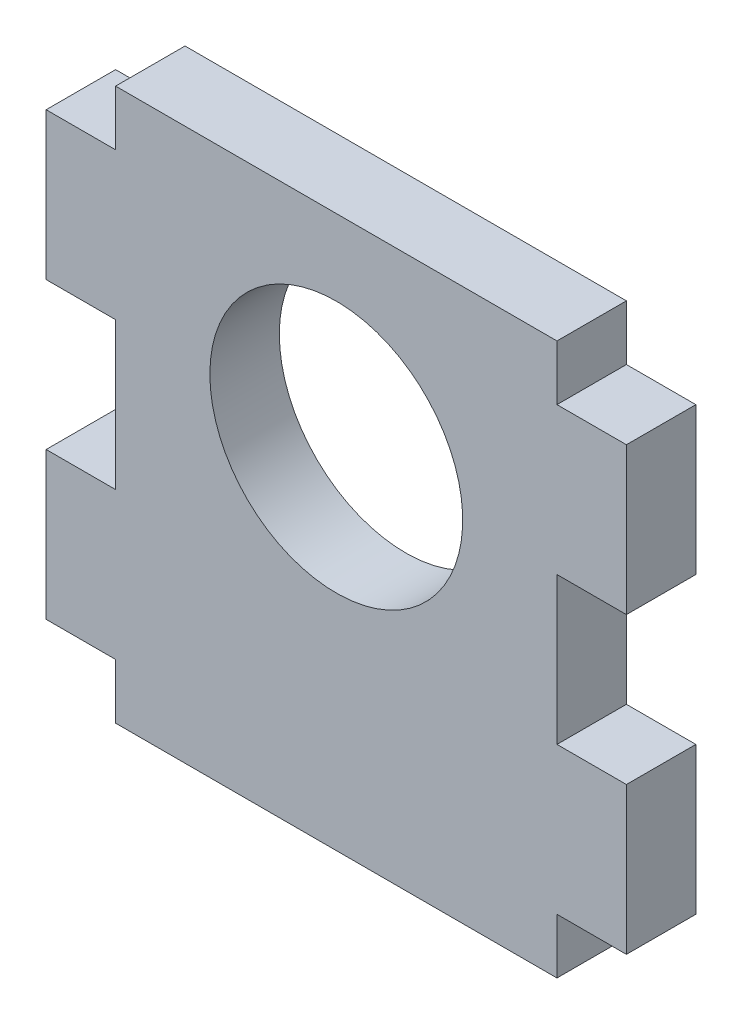
from build123d import *

# Parameters (mm, degrees)
SKETCH1_R           = 10.9125
BOSS_EXTRUDE1_DEPTH = 5.9944
SKETCH2_W           = 38.1
SKETCH2_H           = 1.5875
CUT_EXTRUDE1_DEPTH  = 41.880524736


with BuildPart() as part:
    # Sketch1 → Boss-Extrude1 (new body)
    with BuildSketch(Plane.XY):
        Polygon((19.05, 19.05), (-19.05, 19.05), (-19.05, 12.7), (-25.0444, 12.7), (-25.0444, 0), (-19.05, 0), (-19.05, -12.7), (-25.0444, -12.7), (-25.0444, -25.4), (-19.05, -25.4), (-19.05, -31.75), (19.05, -31.75), (19.05, -25.4), (25.0444, -25.4), (25.0444, -12.7), (19.05, -12.7), (19.05, 0), (25.0444, 0), (25.0444, 12.7), (19.05, 12.7), align=None)
        Circle(SKETCH1_R, mode=Mode.SUBTRACT)
    extrude(amount=BOSS_EXTRUDE1_DEPTH)

    # Sketch2 → Cut-Extrude1 (cut, through all)
    with BuildSketch(Plane.XY.offset(5.9944)):
        with Locations((0, -30.95625)):
            Rectangle(SKETCH2_W, SKETCH2_H)
        with Locations((0, 18.25625)):
            Rectangle(SKETCH2_W, SKETCH2_H)
    extrude(amount=-CUT_EXTRUDE1_DEPTH, mode=Mode.SUBTRACT)


solid = part.part
